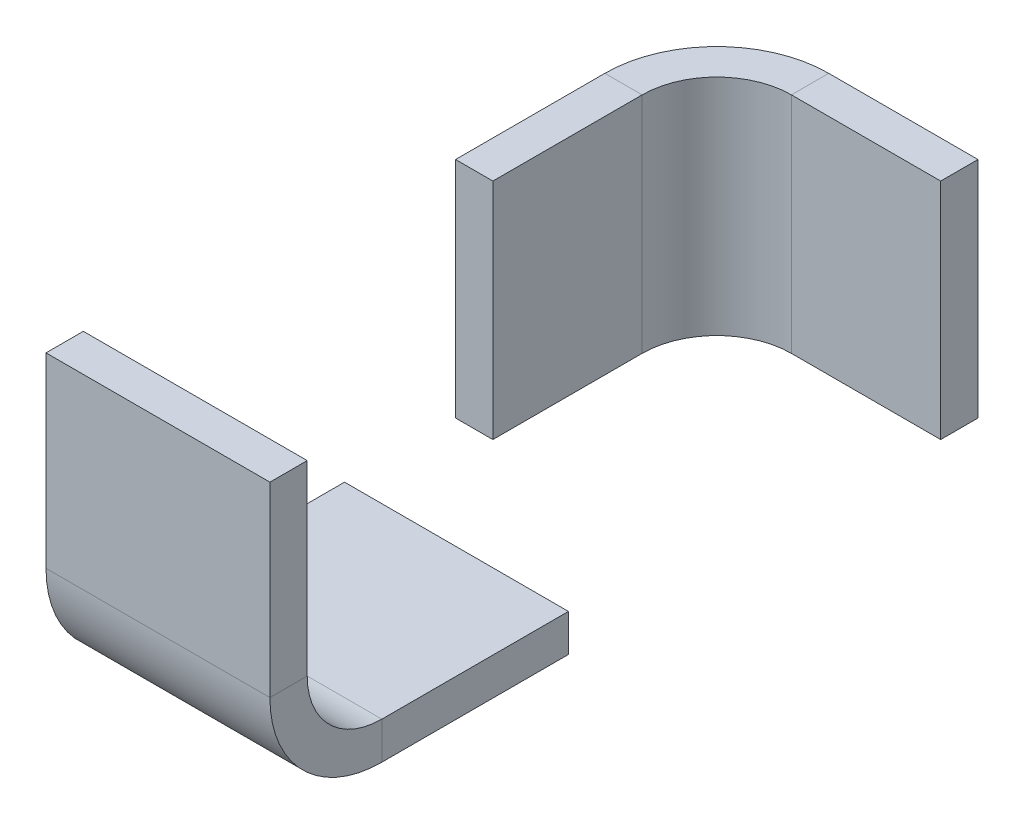
from build123d import *

# Parameters (mm, degrees)
BASE_FLANGE1_DEPTH = 60
BASE_FLANGE2_DEPTH = 60


# Sheet-metal steps are written as plain solids
with BuildPart() as part:
    # Sketch2 → Base-Flange1 (new body)
    with BuildSketch(Plane(origin=(0, 0, 0), x_dir=(1, 0, 0), z_dir=(0, 1, 0))):
        with BuildLine():
            Line((0, 0), (0, 40))
            ThreePointArc((0, 40), (8.786796564, 61.213203436), (30, 70))
            Line((30, 70), (70, 70))
            Line((70, 70), (70, 60))
            Line((70, 60), (30, 60))
            ThreePointArc((30, 60), (15.857864376, 54.142135624), (10, 40))
            Line((10, 40), (10, 0))
            Line((10, 0), (0, 0))
        make_face()
    extrude(amount=BASE_FLANGE1_DEPTH)


with BuildPart() as body_2:
    # Sketch7 → Base-Flange2 (new body)
    with BuildSketch(Plane(origin=(0, 0, 0), x_dir=(0, 0, -1), z_dir=(1, 0, 0))):
        with BuildLine():
            Line((-99.746355884, 70), (-99.746355884, 20))
            ThreePointArc((-99.746355884, 20), (-93.888491507, 5.857864376), (-79.746355884, 0))
            Line((-79.746355884, 0), (-29.746355884, 0))
            Line((-29.746355884, 0), (-29.746355884, -10))
            Line((-29.746355884, -10), (-79.746355884, -10))
            ThreePointArc((-79.746355884, -10), (-100.959559319, -1.213203436), (-109.746355884, 20))
            Line((-109.746355884, 20), (-109.746355884, 70))
            Line((-109.746355884, 70), (-99.746355884, 70))
        make_face()
    extrude(amount=BASE_FLANGE2_DEPTH)


solid = Compound([part.part, body_2.part])
